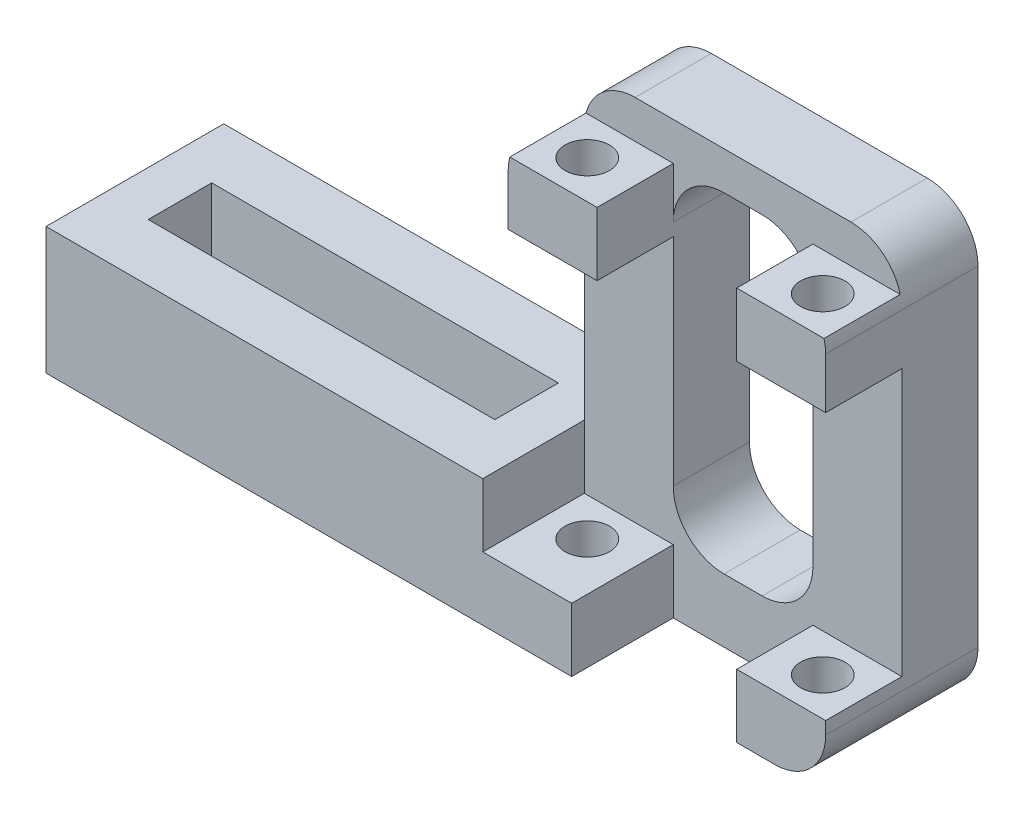
from build123d import *

# Parameters (mm, degrees)
CROQUIS1_W              = 25
CROQUIS1_H              = 34
SALIENTE_EXTRUIR1_DEPTH = 6
CROQUIS2_W              = 7
CROQUIS2_H              = 5
SALIENTE_EXTRUIR2_DEPTH = 6
CORTAR_EXTRUIR1_REACH   = 44.626
CROQUIS3_W              = 11
CROQUIS3_H              = 26
REDONDEO1_R             = 4
SALIENTE_EXTRUIR3_DEPTH = 12
SALIENTE_EXTRUIR4_DEPTH = 2
CORTAR_EXTRUIR2_REACH   = 70.45
CROQUIS7_R              = 1.75
CORTAR_EXTRUIR3_REACH   = 67.577
CROQUIS8_W              = 27.3
CROQUIS8_H              = 5


with BuildPart() as part:
    # Croquis1 → Saliente-Extruir1 (new body)
    with BuildSketch(Plane.XY):
        with Locations((-12.5, -17)):
            Rectangle(CROQUIS1_W, CROQUIS1_H)
    extrude(amount=SALIENTE_EXTRUIR1_DEPTH)

    # Croquis2 → Saliente-Extruir2 (add)
    with BuildSketch(Plane.XY.offset(6)):
        with Locations((-21.5, -5.5)):
            Rectangle(CROQUIS2_W, CROQUIS2_H)
        with Locations((-3.5, -5.5)):
            Rectangle(CROQUIS2_W, CROQUIS2_H)
        with Locations((-3.5, -31.5)):
            Rectangle(CROQUIS2_W, CROQUIS2_H)
        with Locations((-21.5, -31.5)):
            Rectangle(CROQUIS2_W, CROQUIS2_H)
    extrude(amount=SALIENTE_EXTRUIR2_DEPTH)

    # Croquis3 → Cortar-Extruir1 (cut, up to next)
    with BuildSketch(Plane.XY.offset(6), mode=Mode.PRIVATE) as cortar_extruir1_sk1:
        with Locations((-12.5, -16)):
            Rectangle(CROQUIS3_W, CROQUIS3_H)
    cortar_extruir1_tool1 = extrude(cortar_extruir1_sk1.sketch, amount=-CORTAR_EXTRUIR1_REACH, mode=Mode.PRIVATE) & part.part
    add(cortar_extruir1_tool1.solids().sort_by_distance((-12.5, -16, 6))[0], mode=Mode.SUBTRACT)

    # Redondeo1
    # the kernel refuses this fillet: 4 mm, written as the material it adds along each edge
    with BuildSketch(Plane(origin=(-18, -29, 6), x_dir=(0, 1, 0), z_dir=(0, 0, -1)), Plane(origin=(-7, -29, 6), x_dir=(-1, 0, 0), z_dir=(0, 0, -1)), Plane(origin=(-18, -3, 6), x_dir=(1, 0, 0), z_dir=(0, 0, -1))) as redondeo1_piece_1:
        with BuildLine():
            CenterArc((REDONDEO1_R, REDONDEO1_R), REDONDEO1_R, 180, 90)
            Line((0, REDONDEO1_R), (0, 0))
            Line((0, 0), (REDONDEO1_R, 0))
        make_face()
    extrude(amount=6)
    with BuildSketch(Plane(origin=(-7, -3, 6), x_dir=(-1, 0, 0), z_dir=(0, 0, -1))) as redondeo1_piece_2:
        with BuildLine():
            CenterArc((REDONDEO1_R, -REDONDEO1_R), REDONDEO1_R, 90, 90)
            Line((0, -REDONDEO1_R), (0, 0))
            Line((0, 0), (REDONDEO1_R, 0))
        make_face()
    extrude(amount=6)
    # the kernel refuses this fillet: 4 mm, written as the material it takes off along each edge
    with BuildSketch(Plane(origin=(0, 0, -10), x_dir=(-1, 0, 0), z_dir=(0, 0, 1))) as redondeo1_2_piece_1:
        with BuildLine():
            CenterArc((REDONDEO1_R, REDONDEO1_R), REDONDEO1_R, 180, 90)
            Line((0, REDONDEO1_R), (0, 0))
            Line((0, 0), (REDONDEO1_R, 0))
        make_face()
    extrude(amount=26, mode=Mode.SUBTRACT)
    with BuildSketch(Plane(origin=(0, -34, 22), x_dir=(0, 1, 0), z_dir=(0, 0, -1)), Plane(origin=(-25, -34, -10), x_dir=(0, 1, 0), z_dir=(0, 0, 1))) as redondeo1_2_piece_2:
        with BuildLine():
            CenterArc((REDONDEO1_R, -REDONDEO1_R), REDONDEO1_R, 90, 90)
            Line((0, -REDONDEO1_R), (0, 0))
            Line((0, 0), (REDONDEO1_R, 0))
        make_face()
    extrude(amount=32, mode=Mode.SUBTRACT)
    with BuildSketch(Plane(origin=(-25, 0, -10), x_dir=(1, 0, 0), z_dir=(0, 0, 1))) as redondeo1_2_piece_3:
        with BuildLine():
            CenterArc((REDONDEO1_R, -REDONDEO1_R), REDONDEO1_R, 90, 90)
            Line((0, -REDONDEO1_R), (0, 0))
            Line((0, 0), (REDONDEO1_R, 0))
        make_face()
    extrude(amount=26, mode=Mode.SUBTRACT)

    # Croquis5 → Saliente-Extruir3 (add)
    with BuildSketch(Plane(origin=(0, 0, 0), x_dir=(-1, 0, 0), z_dir=(0, 0, -1))):
        with BuildLine():
            Line((25, -29), (25, -30))
            ThreePointArc((25, -30), (23.828427125, -32.828427125), (21, -34))
            Line((21, -34), (25, -34))
            Line((25, -34), (59.4, -34))
            Line((59.4, -34), (59.4, -24))
            Line((59.4, -24), (25, -24))
            Line((25, -24), (25, -29))
        make_face()
    extrude(amount=-SALIENTE_EXTRUIR3_DEPTH)

    # Croquis6 → Saliente-Extruir4 (add)
    with BuildSketch(Plane.XY.offset(12)):
        Polygon((-18, -29), (-25, -29), (-25, -24), (-59.4, -24), (-59.4, -34), (-18, -34), align=None)
    extrude(amount=SALIENTE_EXTRUIR4_DEPTH)

    # Cortar-Extruir2: up to this face of the body (flat: up to its plane)
    cortar_extruir2_end = Plane(part.part.faces().sort_by_distance((-34.409507042, -34, 6.559859155))[0])
    # Croquis7 → Cortar-Extruir2 (cut, up to the picked face)
    with BuildSketch(Plane(origin=(0, -3, 0), x_dir=(1, 0, 0), z_dir=(0, 1, 0)), mode=Mode.PRIVATE) as cortar_extruir2_sk1:
        with Locations(Location((-21.772983346, -9, 0), (0, 0, 270))):
            Circle(CROQUIS7_R)
    cortar_extruir2_tool1 = split(extrude(cortar_extruir2_sk1.sketch, amount=-CORTAR_EXTRUIR2_REACH, mode=Mode.PRIVATE), bisect_by=cortar_extruir2_end, keep=Keep.BOTH, mode=Mode.PRIVATE)
    # Croquis7 → Cortar-Extruir2 (cut, up to the picked face)
    with BuildSketch(Plane(origin=(0, -3, 0), x_dir=(1, 0, 0), z_dir=(0, 1, 0)), mode=Mode.PRIVATE) as cortar_extruir2_sk2:
        with Locations(Location((-3.227016654, -9, 0), (0, 0, 243.787297197))):
            Circle(CROQUIS7_R)
    cortar_extruir2_tool2 = split(extrude(cortar_extruir2_sk2.sketch, amount=-CORTAR_EXTRUIR2_REACH, mode=Mode.PRIVATE), bisect_by=cortar_extruir2_end, keep=Keep.BOTH, mode=Mode.PRIVATE)
    add(cortar_extruir2_tool1.solids().sort_by(Axis((-21.772983, -3, 9), (0, -1, 0)))[0], mode=Mode.SUBTRACT)
    add(cortar_extruir2_tool2.solids().sort_by(Axis((-3.227017, -3, 9), (0, -1, 0)))[0], mode=Mode.SUBTRACT)

    # Croquis8 → Cortar-Extruir3 (cut, up to next)
    with BuildSketch(Plane(origin=(0, -24, 0), x_dir=(1, 0, 0), z_dir=(0, 1, 0)), mode=Mode.PRIVATE) as cortar_extruir3_sk1:
        with Locations((-42.2, -7)):
            Rectangle(CROQUIS8_W, CROQUIS8_H)
    cortar_extruir3_tool1 = extrude(cortar_extruir3_sk1.sketch, amount=-CORTAR_EXTRUIR3_REACH, mode=Mode.PRIVATE) & part.part
    add(cortar_extruir3_tool1.solids().sort_by_distance((-42.2, -24, 7))[0], mode=Mode.SUBTRACT)


solid = part.part
